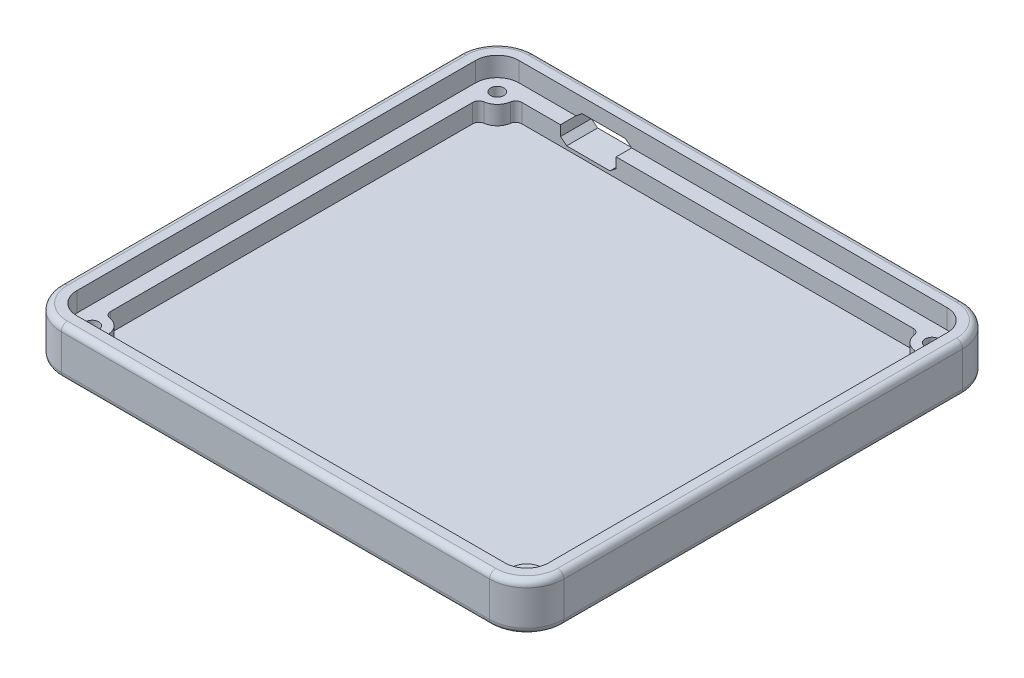
from build123d import *

# Parameters (mm, degrees)
BOSS_EXTRUDE2_DEPTH      = 3
BOSS_EXTRUDE3_DEPTH      = 6
BOSS_EXTRUDE3_DEPTH_BACK = 3
SKETCH3_R                = 2.15
BOSS_EXTRUDE4_DEPTH      = 6.28
CUT_EXTRUDE1_DEPTH       = 10
FILLET1_R                = 2
CUT_EXTRUDE3_DEPTH       = 113.186165145
CUT_EXTRUDE3_DEPTH_BACK  = 113.186165145
SKETCH11_R               = 2.15
CUT_EXTRUDE2_DEPTH       = 4
FILLET4_R                = 2
CUT_EXTRUDE5_DEPTH       = 2
SKETCH14_R               = 10
CUT_EXTRUDE6_DEPTH       = 2


with BuildPart() as part:
    # Sketch2 → Boss-Extrude2 (new body)
    with BuildSketch(Plane(origin=(0, 0, 0), x_dir=(1, 0, 0), z_dir=(0, 1, 0))):
        with BuildLine():
            Line((-69.195, 71.435), (69.195, 71.435))
            ThreePointArc((69.195, 71.435), (74.144747468, 69.384747468), (76.195, 64.435))
            Line((76.195, 64.435), (76.195, -64.435))
            ThreePointArc((76.195, -64.435), (74.144747468, -69.384747468), (69.195, -71.435))
            Line((69.195, -71.435), (-69.195, -71.435))
            ThreePointArc((-69.195, -71.435), (-74.144747468, -69.384747468), (-76.195, -64.435))
            Line((-76.195, -64.435), (-76.195, 64.435))
            ThreePointArc((-76.195, 64.435), (-74.144747468, 69.384747468), (-69.195, 71.435))
        make_face()
    extrude(amount=BOSS_EXTRUDE2_DEPTH)

    # Sketch3 → Boss-Extrude3 (add, two sides: drawn at the far end of the back side and taken through both)
    with BuildSketch(Plane(origin=(0, 3, 0), x_dir=(1, 0, 0), z_dir=(0, 1, 0)).offset(-BOSS_EXTRUDE3_DEPTH_BACK)):
        with BuildLine():
            ThreePointArc((-69.195, 76.435), (-77.680281374, 72.920281374), (-81.195, 64.435))
            Line((-81.195, 64.435), (-81.195, -64.435))
            ThreePointArc((-81.195, -64.435), (-77.680281374, -72.920281374), (-69.195, -76.435))
            Line((-69.195, -76.435), (69.195, -76.435))
            ThreePointArc((69.195, -76.435), (77.680281374, -72.920281374), (81.195, -64.435))
            Line((81.195, -64.435), (81.195, 64.435))
            ThreePointArc((81.195, 64.435), (77.680281374, 72.920281374), (69.195, 76.435))
            Line((69.195, 76.435), (-69.195, 76.435))
        make_face()
        with Locations((-70.2, -65.44)):
            Circle(SKETCH3_R, mode=Mode.SUBTRACT)
        with Locations((70.2, -65.44)):
            Circle(SKETCH3_R, mode=Mode.SUBTRACT)
        with BuildLine():
            Line((-71.195, -60.44), (-71.195, 60.44))
            Line((-71.195, 60.44), (-70.195, 60.44))
            ThreePointArc((-70.195, 60.44), (-66.663001628, 61.903001628), (-65.2, 65.435))
            Line((-65.2, 65.435), (-65.2, 66.435))
            Line((-65.2, 66.435), (65.2, 66.435))
            Line((65.2, 66.435), (65.2, 65.435))
            ThreePointArc((65.2, 65.435), (66.663001628, 61.903001628), (70.195, 60.44))
            Line((70.195, 60.44), (71.195, 60.44))
            Line((71.195, 60.44), (71.195, -60.44))
            Line((71.195, -60.44), (70.195, -60.44))
            ThreePointArc((70.195, -60.44), (66.663001628, -61.903001628), (65.2, -65.435))
            Line((65.2, -65.435), (65.2, -66.435))
            Line((65.2, -66.435), (-65.2, -66.435))
            Line((-65.2, -66.435), (-65.2, -65.435))
            ThreePointArc((-65.2, -65.435), (-66.663001628, -61.903001628), (-70.195, -60.44))
            Line((-70.195, -60.44), (-71.195, -60.44))
        make_face(mode=Mode.SUBTRACT)
        with Locations((-70.2, 65.44)):
            Circle(SKETCH3_R, mode=Mode.SUBTRACT)
        with Locations((70.2, 65.44)):
            Circle(SKETCH3_R, mode=Mode.SUBTRACT)
    extrude(amount=BOSS_EXTRUDE3_DEPTH + BOSS_EXTRUDE3_DEPTH_BACK)

    # Sketch8 → Boss-Extrude4 (add)
    with BuildSketch(Plane(origin=(0, 9, 0), x_dir=(1, 0, 0), z_dir=(0, 1, 0))):
        with BuildLine():
            ThreePointArc((-81.195, -64.435), (-77.680281374, -72.920281374), (-69.195, -76.435))
            Line((-69.195, -76.435), (69.195, -76.435))
            ThreePointArc((69.195, -76.435), (77.680281374, -72.920281374), (81.195, -64.435))
            Line((81.195, -64.435), (81.195, 64.435))
            ThreePointArc((81.195, 64.435), (77.680281374, 72.920281374), (69.195, 76.435))
            Line((69.195, 76.435), (-69.195, 76.435))
            ThreePointArc((-69.195, 76.435), (-77.680281374, 72.920281374), (-81.195, 64.435))
            Line((-81.195, 64.435), (-81.195, -64.435))
        make_face()
        with BuildLine():
            Line((76.195, 64.435), (76.195, -64.435))
            ThreePointArc((76.195, -64.435), (74.144747468, -69.384747468), (69.195, -71.435))
            Line((69.195, -71.435), (-69.195, -71.435))
            ThreePointArc((-69.195, -71.435), (-74.144747468, -69.384747468), (-76.195, -64.435))
            Line((-76.195, -64.435), (-76.195, 64.435))
            ThreePointArc((-76.195, 64.435), (-74.144747468, 69.384747468), (-69.195, 71.435))
            Line((-69.195, 71.435), (69.195, 71.435))
            ThreePointArc((69.195, 71.435), (74.144747468, 69.384747468), (76.195, 64.435))
        make_face(mode=Mode.SUBTRACT)
    extrude(amount=BOSS_EXTRUDE4_DEPTH)

    # Sketch9 → Cut-Extrude1 (cut)
    with BuildSketch(Plane(origin=(0, 0, -76.435), x_dir=(-1, 0, 0), z_dir=(0, 0, -1))):
        Polygon((48.775, 10.605), (34.775, 10.605), (32.775, 9.005), (32.775, 5.685), (34.775, 4.085), (48.775, 4.085), (50.775, 5.685), (50.775, 9.005), align=None)
    extrude(amount=-CUT_EXTRUDE1_DEPTH, mode=Mode.SUBTRACT)

    # Fillet1
    fillet1_edges = [part.edges().sort_by_distance(p)[0] for p in [
        (-65.2, 6, -66.435),
        (-71.195, 6, -60.44),
        (-71.195, 6, 60.44),
        (-65.2, 6, 66.435),
        (71.195, 6, 60.44),
        (65.2, 6, 66.435),
        (65.2, 6, -66.435),
        (71.195, 6, -60.44),
    ]]
    fillet(fillet1_edges, radius=FILLET1_R)

    # Sketch11 → Cut-Extrude3 (cut, two sides: drawn at the far end of the back side and taken through both)
    with BuildSketch(Plane(origin=(0, 3, 0), x_dir=(1, 0, 0), z_dir=(0, 1, 0)).offset(-CUT_EXTRUDE3_DEPTH_BACK)):
        with Locations((-70.2, 65.44)):
            Circle(SKETCH11_R)
        with Locations((70.2, 65.44)):
            Circle(SKETCH11_R)
        with Locations((70.2, -65.496439375)):
            Circle(SKETCH11_R)
        with Locations((-70.2, -65.44)):
            Circle(SKETCH11_R)
    extrude(amount=CUT_EXTRUDE3_DEPTH + CUT_EXTRUDE3_DEPTH_BACK, mode=Mode.SUBTRACT)

    # Sketch10 → Cut-Extrude2 (cut)
    with BuildSketch(Plane.XZ):
        Polygon((66.158548116, 65.44), (68.179274058, 61.94), (72.220725942, 61.94), (74.241451884, 65.44), (72.220725942, 68.94), (68.179274058, 68.94), align=None)
        Polygon((-68.179274058, 61.94), (-66.158548116, 65.44), (-68.179274058, 68.94), (-72.220725942, 68.94), (-74.241451884, 65.44), (-72.220725942, 61.94), align=None)
        Polygon((74.241451884, -65.44), (72.220725942, -61.94), (68.179274058, -61.94), (66.158548116, -65.44), (68.179274058, -68.94), (72.220725942, -68.94), align=None)
        Polygon((-66.158548116, -65.44), (-68.179274058, -61.94), (-72.220725942, -61.94), (-74.241451884, -65.44), (-72.220725942, -68.94), (-68.179274058, -68.94), align=None)
    extrude(amount=-CUT_EXTRUDE2_DEPTH, mode=Mode.SUBTRACT)

    # Fillet4
    fillet4_edges = [part.edges().sort_by_distance(p)[0] for p in [
        (-77.680281374, 0, -72.920281374),
        (0, 0, -76.435),
        (77.680281374, 0, -72.920281374),
        (81.195, 0, 0),
        (77.680281374, 0, 72.920281374),
        (0, 0, 76.435),
        (-77.680281374, 0, 72.920281374),
        (-77.680281374, 15.28, -72.920281374),
        (0, 15.28, -76.435),
        (77.680281374, 15.28, -72.920281374),
        (81.195, 15.28, 0),
        (77.680281374, 15.28, 72.920281374),
        (0, 15.28, 76.435),
        (-77.680281374, 15.28, 72.920281374),
        (-81.195, 0, 0),
        (-81.195, 15.28, 0),
    ]]
    fillet(fillet4_edges, radius=FILLET4_R)

    # Sketch13 → Cut-Extrude5 (cut)
    with BuildSketch(Plane.XZ):
        with BuildLine():
            Line((-15, -25.435), (15, -25.435))
            ThreePointArc((15, -25.435), (21, -31.435), (15, -37.435))
            Line((15, -37.435), (-15, -37.435))
            ThreePointArc((-15, -37.435), (-21, -31.435), (-15, -25.435))
        make_face()
    extrude(amount=-CUT_EXTRUDE5_DEPTH, mode=Mode.SUBTRACT)

    # Sketch14 → Cut-Extrude6 (cut)
    with BuildSketch(Plane.XZ):
        with Locations((-55, -56.435)):
            Circle(SKETCH14_R)
        with Locations((55, -56.435)):
            Circle(SKETCH14_R)
    extrude(amount=-CUT_EXTRUDE6_DEPTH, mode=Mode.SUBTRACT)


solid = part.part
